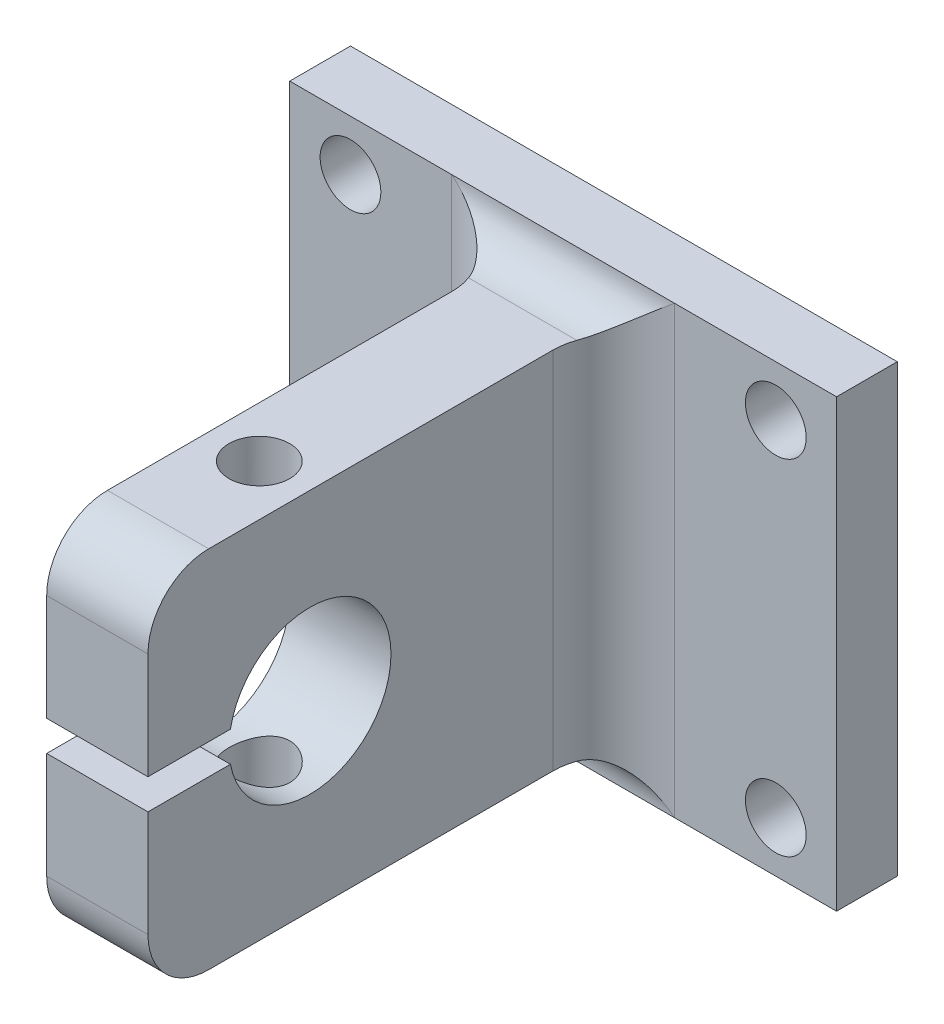
from build123d import *

# Parameters (mm, degrees)
SKETCH1_W               = 27
SKETCH1_H               = 22
SKETCH1_R               = 1.5
BOSS_EXTRUDE1_DEPTH     = 3
SKETCH2_W               = 5
SKETCH2_H               = 18
BOSS_EXTRUDE2_DEPTH     = 23
CUT_EXTRUDE1_DEPTH      = 33.449961479
CUT_EXTRUDE1_DEPTH_BACK = 33.449961479
SKETCH3_R               = 4
CUT_EXTRUDE2_DEPTH      = 33.449961479
CUT_EXTRUDE2_DEPTH_BACK = 33.449961479
SKETCH4_W               = 9.515030356
SKETCH4_H               = 1.5
FILLET1_R               = 3
CUT_EXTRUDE3_DEPTH      = 37.636730203
CUT_EXTRUDE3_DEPTH_BACK = 37.636730203
SKETCH5_R               = 1.5
FILLET2_R               = 2
FILLET3_R               = 3


with BuildPart() as part:
    # Sketch1 → Boss-Extrude1 (new body)
    with BuildSketch(Plane.XY):
        Rectangle(SKETCH1_W, SKETCH1_H)
        with Locations((-10.5, -8.5)):
            Circle(SKETCH1_R, mode=Mode.SUBTRACT)
        with Locations((-10.5, 8.5)):
            Circle(SKETCH1_R, mode=Mode.SUBTRACT)
        with Locations((10.5, 8.5)):
            Circle(SKETCH1_R, mode=Mode.SUBTRACT)
        with Locations((10.5, -8.5)):
            Circle(SKETCH1_R, mode=Mode.SUBTRACT)
    extrude(amount=BOSS_EXTRUDE1_DEPTH)

    # Sketch2 → Boss-Extrude2 (add)
    with BuildSketch(Plane.XY.offset(3)):
        Rectangle(SKETCH2_W, SKETCH2_H)
    extrude(amount=BOSS_EXTRUDE2_DEPTH)

    # Sketch3 → Cut-Extrude1 (cut, two sides: drawn at the far end of the back side and taken through both)
    with BuildSketch(Plane(origin=(2.5, 0, 0), x_dir=(0, 0, -1), z_dir=(1, 0, 0)).offset(-CUT_EXTRUDE1_DEPTH_BACK)):
        with Locations(Location((-18, 0, 0), (0, 0, 180))):
            Circle(SKETCH3_R)
    extrude(amount=CUT_EXTRUDE1_DEPTH + CUT_EXTRUDE1_DEPTH_BACK, mode=Mode.SUBTRACT)

    # Sketch4 → Cut-Extrude2 (cut, two sides: drawn at the far end of the back side and taken through both)
    with BuildSketch(Plane(origin=(2.5, 0, 0), x_dir=(0, 0, -1), z_dir=(1, 0, 0)).offset(-CUT_EXTRUDE2_DEPTH_BACK)):
        with Locations((-21.491106051, 0)):
            Rectangle(SKETCH4_W, SKETCH4_H)
    extrude(amount=CUT_EXTRUDE2_DEPTH + CUT_EXTRUDE2_DEPTH_BACK, mode=Mode.SUBTRACT)

    # Fillet1
    fillet1_edges = [part.edges().sort_by_distance(p)[0] for p in [
        (-2.5, 0, 3),
        (2.5, 0, 3),
    ]]
    fillet(fillet1_edges, radius=FILLET1_R)

    # Sketch5 → Cut-Extrude3 (cut, two sides: drawn at the far end of the back side and taken through both)
    with BuildSketch(Plane(origin=(0, 11, 0), x_dir=(1, 0, 0), z_dir=(0, 1, 0)).offset(-CUT_EXTRUDE3_DEPTH_BACK)):
        with Locations(Location((0, -18, 0), (0, 0, 270))):
            Circle(SKETCH5_R)
    extrude(amount=CUT_EXTRUDE3_DEPTH + CUT_EXTRUDE3_DEPTH_BACK, mode=Mode.SUBTRACT)

    # Fillet2
    fillet2_edges = [part.edges().sort_by_distance(p)[0] for p in [
        (0, -9, 3),
        (0, 9, 3),
    ]]
    fillet(fillet2_edges, radius=FILLET2_R - 0.0001)  # a hair under: the kernel refuses the full size

    # Fillet3
    fillet3_edges = [part.edges().sort_by_distance(p)[0] for p in [
        (0, -9, 26),
        (0, 9, 26),
    ]]
    fillet(fillet3_edges, radius=FILLET3_R)


solid = part.part
